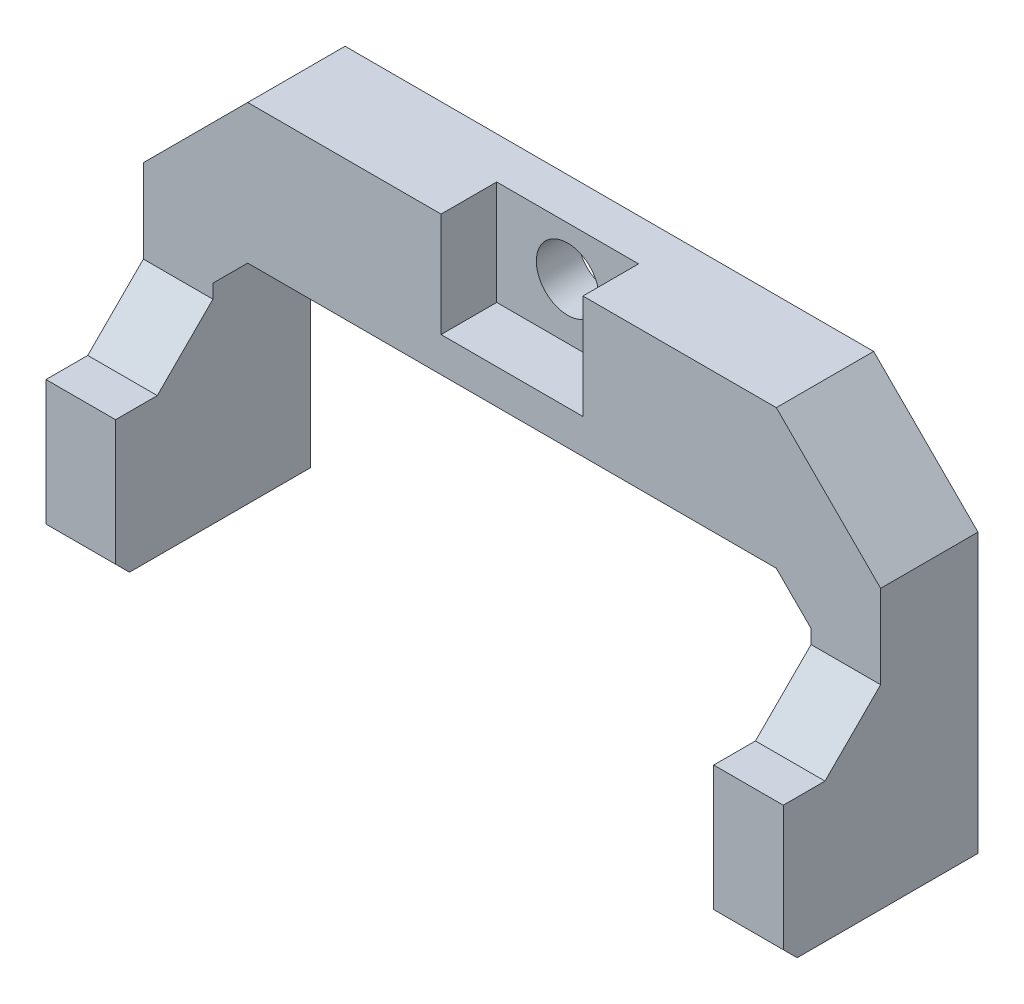
from build123d import *

# Parameters (mm, degrees)
BOSS_EXTRUDE1_DEPTH  = 7
SKETCH6_W            = 5
SKETCH6_H            = 10
BOSS_EXTRUDE2_DEPTH  = 7
SKETCH3_W            = 5.1
SKETCH3_H            = 7.5
CUT_EXTRUDE1_DEPTH   = 4
M4_CLEARANCE_HOLE1_D = 4.5
CHAMFER2_SIZE        = 4
CHAMFER3_SIZE        = 1


with BuildPart() as part:
    # Sketch1 → Boss-Extrude1 (new body)
    with BuildSketch(Plane.XY):
        Polygon((0, 0), (0, -10), (-19, -10), (-21.5, -12.5), (-21.5, -27.5), (-26.5, -27.5), (-26.5, -7.5), (-19, 0), align=None)
    boss_extrude1 = extrude(amount=BOSS_EXTRUDE1_DEPTH)

    # Sketch6 → Boss-Extrude2 (add)
    with BuildSketch(Plane.XY.offset(7)):
        with Locations((-24, -22.5)):
            Rectangle(SKETCH6_W, SKETCH6_H)
    boss_extrude2 = extrude(amount=BOSS_EXTRUDE2_DEPTH)

    # Sketch3 → Cut-Extrude1 (cut)
    with BuildSketch(Plane.XY.offset(7)):
        with Locations((-2.55, -3.75)):
            Rectangle(SKETCH3_W, SKETCH3_H)
    cut_extrude1 = extrude(amount=-CUT_EXTRUDE1_DEPTH, mode=Mode.SUBTRACT)

    # Mirror1: Boss-Extrude1, Boss-Extrude2, Cut-Extrude1 across plane
    add(boss_extrude1.mirror(Plane(origin=(0, 0, 7), x_dir=(0, 0, 1), z_dir=(-1, 0, 0))))
    add(boss_extrude2.mirror(Plane(origin=(0, 0, 7), x_dir=(0, 0, 1), z_dir=(-1, 0, 0))))
    add(cut_extrude1.mirror(Plane(origin=(0, 0, 7), x_dir=(0, 0, 1), z_dir=(-1, 0, 0))), mode=Mode.SUBTRACT)

    # M4 Clearance Hole1 (through all)
    with Locations(Plane.XY.offset(3)):
        with Locations((0, -3.5)):
            Hole(M4_CLEARANCE_HOLE1_D / 2)

    # Chamfer2
    chamfer2_edges = [part.edges().sort_by_distance(p)[0] for p in [
        (24, -17.5, 7),
        (-24, -17.5, 7),
    ]]
    chamfer(chamfer2_edges, length=CHAMFER2_SIZE)

    # Chamfer3
    chamfer3_edges = [part.edges().sort_by_distance(p)[0] for p in [
        (24, -27.5, 14),
        (-24, -27.5, 14),
    ]]
    chamfer(chamfer3_edges, length=CHAMFER3_SIZE)


solid = part.part
